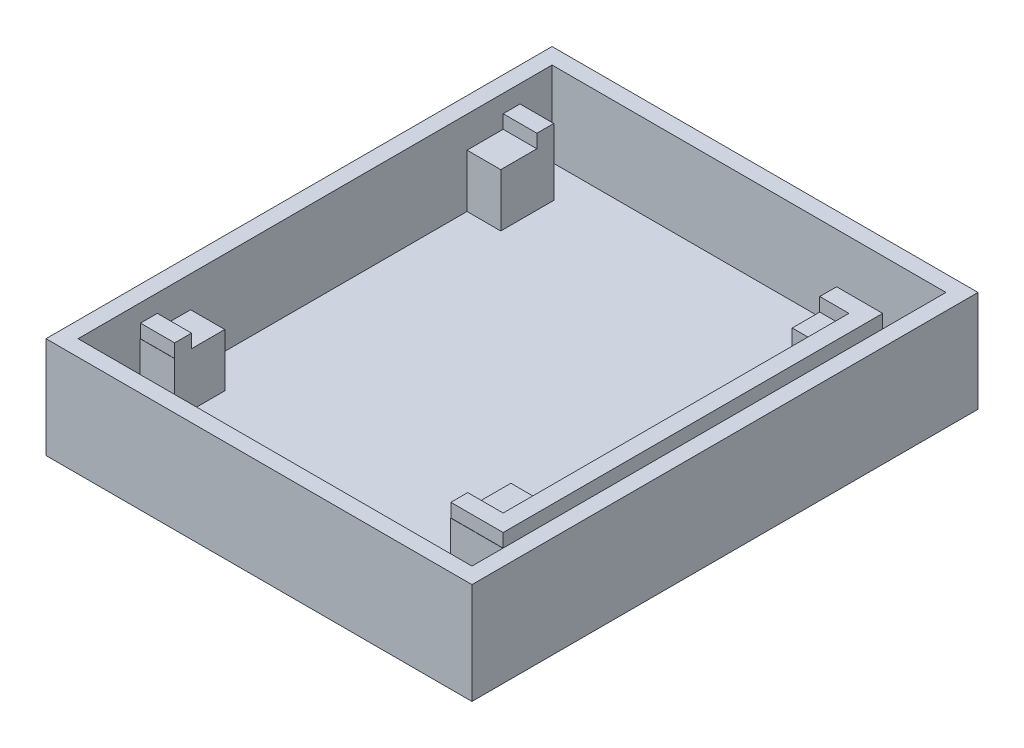
from build123d import *

# Parameters (mm, degrees)
SCHIZZO1_W                    = 50.5
SCHIZZO1_H                    = 60
ESTRUSIONE_ESTRUSIONE1_DEPTH  = 2
SCHIZZO2_W                    = 1.9
SCHIZZO2_H                    = 60
ESTRUSIONE_ESTRUSIONE2_DEPTH  = 10
SCHIZZO3_W                    = 48.6
SCHIZZO3_H                    = 1.9
ESTRUSIONE_ESTRUSIONE3_DEPTH  = 10
SCHIZZO4_W                    = 1.9
SCHIZZO4_H                    = 58.1
ESTRUSIONE_ESTRUSIONE4_DEPTH  = 10
SCHIZZO5_W                    = 46.7
SCHIZZO5_H                    = 1.9
ESTRUSIONE_ESTRUSIONE5_DEPTH  = 10
SCHIZZO8_W                    = 4
SCHIZZO8_H                    = 7
ESTRUSIONE_ESTRUSIONE6_DEPTH  = 6.3
SCHIZZO13_W                   = 5.860494721
SCHIZZO13_H                   = 5.979095524
ESTRUSIONE_ESTRUSIONE12_DEPTH = 6.3
SCHIZZO14_W                   = 6.597450739
SCHIZZO14_H                   = 7.143592965
ESTRUSIONE_ESTRUSIONE13_DEPTH = 6.3
SCHIZZO15_W                   = 4.05309551
SCHIZZO15_H                   = 5.969817473
ESTRUSIONE_ESTRUSIONE14_DEPTH = 6.3
SCHIZZO16_W                   = 4
SCHIZZO16_H                   = 2
ESTRUSIONE_ESTRUSIONE15_DEPTH = 1.6
SCHIZZO17_W                   = 3.463606933
SCHIZZO17_H                   = 2
ESTRUSIONE_ESTRUSIONE16_DEPTH = 1.6
SCHIZZO18_W                   = 2
SCHIZZO18_H                   = 5.261209452
ESTRUSIONE_ESTRUSIONE17_DEPTH = 1.6
SCHIZZO19_W                   = 2
SCHIZZO19_H                   = 5.1200622
ESTRUSIONE_ESTRUSIONE18_DEPTH = 1.6
SCHIZZO23_W                   = 6.200562951
SCHIZZO23_H                   = 2
ESTRUSIONE_ESTRUSIONE19_DEPTH = 1.6
SCHIZZO25_W                   = 4.05309551
SCHIZZO25_H                   = 2
ESTRUSIONE_ESTRUSIONE20_DEPTH = 1.6
SCHIZZO26_W                   = 0.396887788
SCHIZZO26_H                   = 7.143592965
TAGLIO_ESTRUSIONE1_DEPTH      = 6.3
SCHIZZO27_W                   = 0.396887788
SCHIZZO27_H                   = 5.979095524
TAGLIO_ESTRUSIONE2_DEPTH      = 6.3
SCHIZZO28_W                   = 5.463606933
SCHIZZO28_H                   = 0.717886072
TAGLIO_ESTRUSIONE3_DEPTH      = 6.3
SCHIZZO29_W                   = 4
SCHIZZO29_H                   = 0.71692884
TAGLIO_ESTRUSIONE4_DEPTH      = 6.3
SCHIZZO30_W                   = 2
SCHIZZO30_H                   = 1.6
ESTRUSIONE_ESTRUSIONE21_DEPTH = 33.3


with BuildPart() as part:
    # Schizzo1 → Estrusione-Estrusione1 (new body)
    with BuildSketch(Plane(origin=(0, 0, 0), x_dir=(1, 0, 0), z_dir=(0, 1, 0))):
        with Locations((25.25, 30)):
            Rectangle(SCHIZZO1_W, SCHIZZO1_H)
    extrude(amount=ESTRUSIONE_ESTRUSIONE1_DEPTH)

    # Schizzo2 → Estrusione-Estrusione2 (add)
    with BuildSketch(Plane(origin=(0, 2, 0), x_dir=(1, 0, 0), z_dir=(0, 1, 0))):
        with Locations((0.95, 30)):
            Rectangle(SCHIZZO2_W, SCHIZZO2_H)
    extrude(amount=ESTRUSIONE_ESTRUSIONE2_DEPTH)

    # Schizzo3 → Estrusione-Estrusione3 (add)
    with BuildSketch(Plane(origin=(0, 2, 0), x_dir=(1, 0, 0), z_dir=(0, 1, 0))):
        with Locations((26.2, 59.05)):
            Rectangle(SCHIZZO3_W, SCHIZZO3_H)
    extrude(amount=ESTRUSIONE_ESTRUSIONE3_DEPTH)

    # Schizzo4 → Estrusione-Estrusione4 (add)
    with BuildSketch(Plane(origin=(0, 2, 0), x_dir=(1, 0, 0), z_dir=(0, 1, 0))):
        with Locations((49.55, 29.05)):
            Rectangle(SCHIZZO4_W, SCHIZZO4_H)
    extrude(amount=ESTRUSIONE_ESTRUSIONE4_DEPTH)

    # Schizzo5 → Estrusione-Estrusione5 (add)
    with BuildSketch(Plane(origin=(0, 2, 0), x_dir=(1, 0, 0), z_dir=(0, 1, 0))):
        with Locations((25.25, 0.95)):
            Rectangle(SCHIZZO5_W, SCHIZZO5_H)
    extrude(amount=ESTRUSIONE_ESTRUSIONE5_DEPTH)

    # Schizzo8 → Estrusione-Estrusione6 (add)
    with BuildSketch(Plane(origin=(0, 2, 0), x_dir=(1, 0, 0), z_dir=(0, 1, 0))):
        with Locations((3.9, 51.517401634)):
            Rectangle(SCHIZZO8_W, SCHIZZO8_H)
    extrude(amount=ESTRUSIONE_ESTRUSIONE6_DEPTH)

    # Schizzo13 → Estrusione-Estrusione12 (add)
    with BuildSketch(Plane(origin=(0, 2, 0), x_dir=(1, 0, 0), z_dir=(0, 1, 0))):
        with Locations((42.366640428, 52.027853872)):
            Rectangle(SCHIZZO13_W, SCHIZZO13_H)
    extrude(amount=ESTRUSIONE_ESTRUSIONE12_DEPTH)

    # Schizzo14 → Estrusione-Estrusione13 (add)
    with BuildSketch(Plane(origin=(0, 2, 0), x_dir=(1, 0, 0), z_dir=(0, 1, 0))):
        with Locations((41.998162419, 12.844625208)):
            Rectangle(SCHIZZO14_W, SCHIZZO14_H)
    extrude(amount=ESTRUSIONE_ESTRUSIONE13_DEPTH)

    # Schizzo15 → Estrusione-Estrusione14 (add)
    with BuildSketch(Plane(origin=(0, 2, 0), x_dir=(1, 0, 0), z_dir=(0, 1, 0))):
        with Locations((3.926547755, 12.257737461)):
            Rectangle(SCHIZZO15_W, SCHIZZO15_H)
    extrude(amount=ESTRUSIONE_ESTRUSIONE14_DEPTH)

    # Schizzo16 → Estrusione-Estrusione15 (add)
    with BuildSketch(Plane(origin=(0, 8.3, 0), x_dir=(1, 0, 0), z_dir=(0, 1, 0))):
        with Locations((3.9, 53.300472794)):
            Rectangle(SCHIZZO16_W, SCHIZZO16_H)
    extrude(amount=ESTRUSIONE_ESTRUSIONE15_DEPTH)

    # Schizzo17 → Estrusione-Estrusione16 (add)
    with BuildSketch(Plane(origin=(0, 8.3, 0), x_dir=(1, 0, 0), z_dir=(0, 1, 0))):
        with Locations((41.168196534, 53.300472794)):
            Rectangle(SCHIZZO17_W, SCHIZZO17_H)
    extrude(amount=ESTRUSIONE_ESTRUSIONE16_DEPTH)

    # Schizzo18 → Estrusione-Estrusione17 (add)
    with BuildSketch(Plane(origin=(0, 8.3, 0), x_dir=(1, 0, 0), z_dir=(0, 1, 0))):
        with Locations((43.9, 51.668910836)):
            Rectangle(SCHIZZO18_W, SCHIZZO18_H)
    extrude(amount=ESTRUSIONE_ESTRUSIONE17_DEPTH)

    # Schizzo19 → Estrusione-Estrusione18 (add)
    with BuildSketch(Plane(origin=(0, 8.3, 0), x_dir=(1, 0, 0), z_dir=(0, 1, 0))):
        with Locations((43.9, 13.860505662)):
            Rectangle(SCHIZZO19_W, SCHIZZO19_H)
    extrude(amount=ESTRUSIONE_ESTRUSIONE18_DEPTH)

    # Schizzo23 → Estrusione-Estrusione19 (add)
    with BuildSketch(Plane(origin=(0, 8.3, 0), x_dir=(1, 0, 0), z_dir=(0, 1, 0))):
        with Locations((41.799718525, 10.300474562)):
            Rectangle(SCHIZZO23_W, SCHIZZO23_H)
    extrude(amount=ESTRUSIONE_ESTRUSIONE19_DEPTH)

    # Schizzo25 → Estrusione-Estrusione20 (add)
    with BuildSketch(Plane(origin=(0, 8.3, 0), x_dir=(1, 0, 0), z_dir=(0, 1, 0))):
        with Locations((3.926547755, 10.299277402)):
            Rectangle(SCHIZZO25_W, SCHIZZO25_H)
    extrude(amount=ESTRUSIONE_ESTRUSIONE20_DEPTH)

    # Schizzo26 → Taglio-Estrusione1 (cut)
    with BuildSketch(Plane(origin=(0, 8.3, 0), x_dir=(1, 0, 0), z_dir=(0, 1, 0))):
        with Locations((45.098443894, 12.844625208)):
            Rectangle(SCHIZZO26_W, SCHIZZO26_H)
    extrude(amount=-TAGLIO_ESTRUSIONE1_DEPTH, mode=Mode.SUBTRACT)

    # Schizzo27 → Taglio-Estrusione2 (cut)
    with BuildSketch(Plane(origin=(0, 8.3, 0), x_dir=(1, 0, 0), z_dir=(0, 1, 0))):
        with Locations((45.098443894, 52.027853872)):
            Rectangle(SCHIZZO27_W, SCHIZZO27_H)
    extrude(amount=-TAGLIO_ESTRUSIONE2_DEPTH, mode=Mode.SUBTRACT)

    # Schizzo28 → Taglio-Estrusione3 (cut)
    with BuildSketch(Plane(origin=(0, 8.3, 0), x_dir=(1, 0, 0), z_dir=(0, 1, 0))):
        with Locations((42.168196534, 54.658458598)):
            Rectangle(SCHIZZO28_W, SCHIZZO28_H)
    extrude(amount=-TAGLIO_ESTRUSIONE3_DEPTH, mode=Mode.SUBTRACT)

    # Schizzo29 → Taglio-Estrusione4 (cut)
    with BuildSketch(Plane(origin=(0, 8.3, 0), x_dir=(1, 0, 0), z_dir=(0, 1, 0))):
        with Locations((3.9, 54.658937214)):
            Rectangle(SCHIZZO29_W, SCHIZZO29_H)
    extrude(amount=-TAGLIO_ESTRUSIONE4_DEPTH, mode=Mode.SUBTRACT)

    # Schizzo30 → Estrusione-Estrusione21 (add)
    with BuildSketch(Plane.XY.offset(-49.03830611)):
        with Locations((43.9, 9.1)):
            Rectangle(SCHIZZO30_W, SCHIZZO30_H)
    extrude(amount=ESTRUSIONE_ESTRUSIONE21_DEPTH)


solid = part.part
